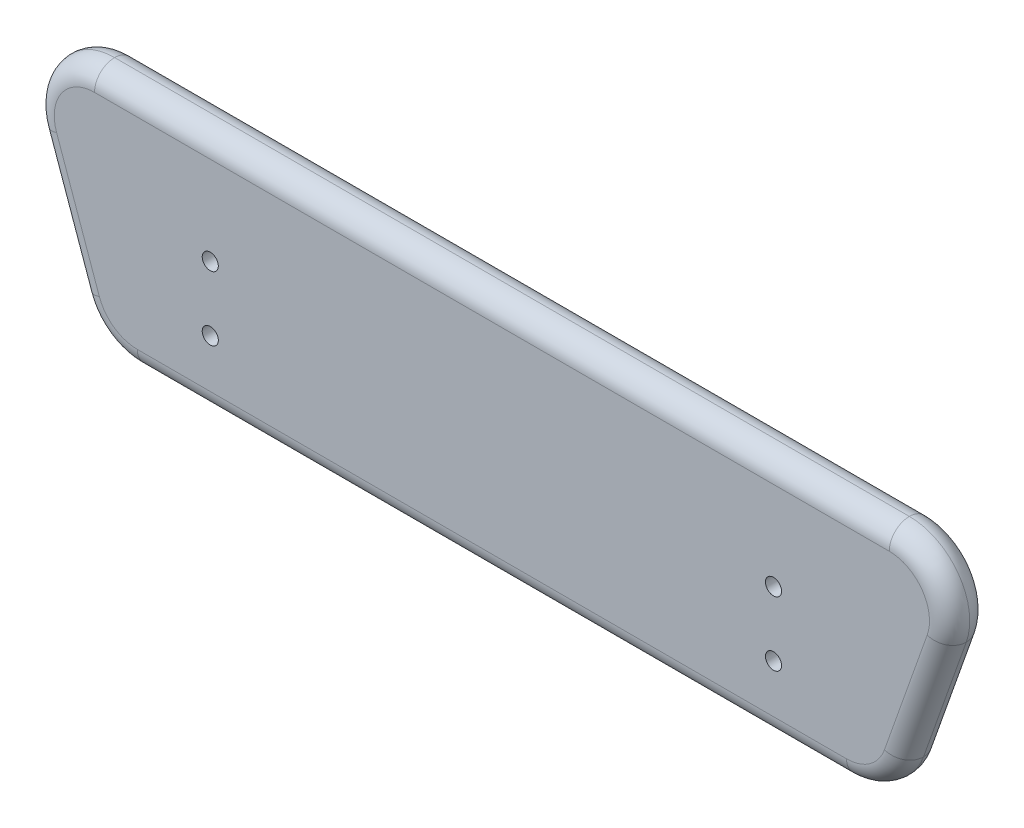
from build123d import *

# Parameters (mm, degrees)
EXTRUDE_1_DEPTH     = 10
FILLET_1_R          = 15
FILLET_2_R          = 5
SKETCH_2_R          = 2
CUT_EXTRUDE_1_DEPTH = 7.5


with BuildPart() as part:
    # 草圖1 → 填料-伸長1 (new body)
    with BuildSketch(Plane.XY):
        Polygon((-123.946188341, 3.497757848), (-102.699073989, -56.502242152), (94.806697307, -56.502242152), (116.053811659, 3.497757848), align=None)
    extrude(amount=EXTRUDE_1_DEPTH)

    # 圓角1
    fillet_1_edges = [part.edges().sort_by_distance(p)[0] for p in [
        (116.053811659, 3.497757848, 5),
        (94.806697307, -56.502242152, 5),
        (-102.699073989, -56.502242152, 5),
        (-123.946188341, 3.497757848, 5),
    ]]
    fillet(fillet_1_edges, radius=FILLET_1_R)

    # 圓角2
    fillet_2_edges = [part.edges().sort_by_distance(p)[0] for p in [
        (107.078925905, -2.845064302, 10),
        (103.657146356, -31.509345041, 10),
        (92.862923252, -53.75186548, 10),
        (-3.946188341, -56.502242152, 10),
        (-100.755299934, -53.75186548, 10),
        (-111.549523037, -31.509345041, 10),
        (-114.971302586, -2.845064302, 10),
        (-3.946188341, 3.497757848, 10),
        (-114.971302586, -2.845064302, 0),
        (-111.549523037, -31.509345041, 0),
        (-100.755299934, -53.75186548, 0),
        (-3.946188341, -56.502242152, 0),
        (92.862923252, -53.75186548, 0),
        (103.657146356, -31.509345041, 0),
        (107.078925905, -2.845064302, 0),
        (-3.946188341, 3.497757848, 0),
    ]]
    fillet(fillet_2_edges, radius=FILLET_2_R - 0.0001)  # a hair under: the kernel refuses the full size

    # 草圖2 → 除料-伸長1 (cut)
    with BuildSketch(Plane.XY.offset(10)):
        with Locations((-73.946188341, -23.502242152)):
            Circle(SKETCH_2_R)
        with Locations((-73.946188341, -39.502242152)):
            Circle(SKETCH_2_R)
        with Locations(Location((66.053811659, -39.502242152, 0), (0, 0, 180))):
            Circle(SKETCH_2_R)
        with Locations(Location((66.053811659, -23.502242152, 0), (0, 0, 180))):
            Circle(SKETCH_2_R)
    extrude(amount=-CUT_EXTRUDE_1_DEPTH, mode=Mode.SUBTRACT)


solid = part.part
